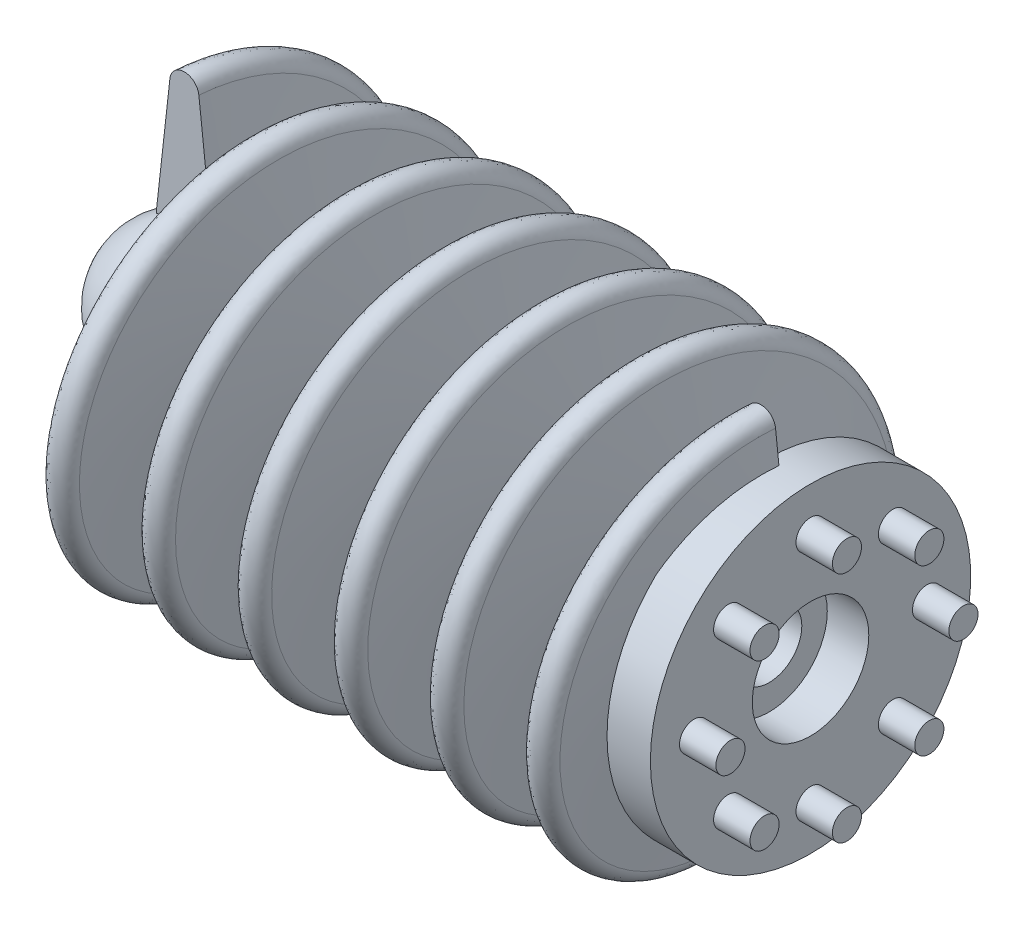
from build123d import *

# Parameters (mm, degrees)
FILLET6_R           = 5
SKETCH9_R           = 4
CUT_EXTRUDE1_DEPTH  = 2.85
SKETCH10_R          = 2.25
CUT_EXTRUDE2_DEPTH  = 2.5
SKETCH11_R          = 1
BOSS_EXTRUDE1_DEPTH = 2.5
CIRPATTERN1_COUNT   = 8
SWEEP2_PITCH        = 6.6


with BuildPart() as part:
    # Sketch2 → Revolve1 (revolve)
    with BuildSketch(Plane.XY, mode=Mode.PRIVATE) as revolve1_sk:
        Polygon((-35.423255814, -11.586046512), (12.576744186, -11.586046512), (12.576744186, -0.586046512), (9.6, -0.586046512), (9.6, -6.586046512), (-35.423255814, -6.586046512), align=None)
    revolve(revolve1_sk.sketch.rotate(Axis((-35.423255814, -11.586046512, 0), (1, 0, 0)), 90), axis=Axis((-35.423255814, -11.586046512, 0), (1, 0, 0)))

    # Fillet6
    fillet6_edges = [part.edges().sort_by_distance(p)[0] for p in [
        (-35.423255814, -11.586046512, -5),
    ]]
    fillet(fillet6_edges, radius=FILLET6_R)

    # Sketch9 → Cut-Extrude1 (cut)
    with BuildSketch(Plane(origin=(12.576744186, 0, 0), x_dir=(0, 0, -1), z_dir=(1, 0, 0))):
        with Locations((0, -11.586046512)):
            Circle(SKETCH9_R)
    extrude(amount=-CUT_EXTRUDE1_DEPTH, mode=Mode.SUBTRACT)

    # Sketch10 → Cut-Extrude2 (cut)
    with BuildSketch(Plane(origin=(9.726744186, 0, 0), x_dir=(0, 0, -1), z_dir=(1, 0, 0))):
        with Locations((0, -11.586046512)):
            Circle(SKETCH10_R)
    extrude(amount=-CUT_EXTRUDE2_DEPTH, mode=Mode.SUBTRACT)

    # Sketch11 → Boss-Extrude1 (add)
    with BuildSketch(Plane(origin=(12.576744186, 0, 0), x_dir=(0, 0, -1), z_dir=(1, 0, 0))):
        with Locations(Location((0, -3.586046512, 0), (0, 0, 180))):
            Circle(SKETCH11_R)
    boss_extrude1 = extrude(amount=BOSS_EXTRUDE1_DEPTH)

    # CirPattern1: Boss-Extrude1 ×8 about axis
    cirpattern1_axis = Axis((0, -11.586046512, 0), (1, 0, 0))
    for i in range(1, CIRPATTERN1_COUNT):
        add(boss_extrude1.rotate(cirpattern1_axis, i * 360 / CIRPATTERN1_COUNT))

    # Sweep2: arcs per turn and ends read off the stored shape
    # Sweep2: the profile of Sketch7 screwed along a left-hand helix through 6 turns, 14 arcs to a turn; built about Z, then put on its axis
    sweep2_z = Axis((0, 0, 0), (0, 0, 1))
    sweep2_corners = [(13.111031511, 0, -0.570561072), (5, 0, -1.476744186), (4.3, 0, -1.476744186), (4.3, 0, 0.423255814), (4.3, 0, 2.323255814), (5, 0, 2.323255814), (13.111031511, 0, 1.4170727), (14, 0, 0.423255814)]
    with BuildLine(mode=Mode.PRIVATE) as sweep2_profile:
        Line(sweep2_corners[0], sweep2_corners[1])
        Line(sweep2_corners[1], sweep2_corners[2])
        Line(sweep2_corners[2], sweep2_corners[3])
        Line(sweep2_corners[3], sweep2_corners[4])
        Line(sweep2_corners[4], sweep2_corners[5])
        Line(sweep2_corners[5], sweep2_corners[6])
        ThreePointArc((13.111031511, 0, 1.4170727), (13.745329293, 0, 1.08995233), (14, 0, 0.423255814))
        ThreePointArc((14, 0, 0.423255814), (13.745329293, 0, -0.243440702), (13.111031511, 0, -0.570561072))
    sweep2_cap = Face(sweep2_profile.wire())
    sweep2_arcs = [((13.111031511, 0, 1.4170727), (14, 0, 1.317755094), (14, 0, 0.423255814), (1, 0.7453292931709528, 1)), ((14, 0, 0.423255814), (14, 0, -0.471243466), (13.111031511, 0, -0.570561072), (1, 0.7453292931709528, 1))]  # start, shoulder, end, weights
    sweep2_turn_angles = [0, -12.857142857, -25.714285714, -38.571428571, -51.428571429, -64.285714286, -77.142857143, -90, -102.857142857, -115.714285714, -128.571428571, -141.428571429, -154.285714286, -167.142857143, -180, -192.857142857, -205.714285714, -218.571428571, -231.428571429, -244.285714286, -257.142857143, -270, -282.857142857, -295.714285714, -308.571428571, -321.428571429, -334.285714286, -347.142857143, -360]
    sweep2_turn_weights = [1, 0.9749279121818236, 1, 0.9749279121818236, 1, 0.9749279121818236, 1, 0.9749279121818236, 1, 0.9749279121818236, 1, 0.9749279121818236, 1, 0.9749279121818236, 1, 0.9749279121818236, 1, 0.9749279121818236, 1, 0.9749279121818236, 1, 0.9749279121818236, 1, 0.9749279121818237, 1, 0.9749279121818236, 1, 0.9749279121818236, 1]
    sweep2_turn_rails = [Edge.make_bspline([Vector(p[0], p[1], 0).rotate(sweep2_z, sweep2_turn_angles[k]) / sweep2_turn_weights[k] + Vector(0, 0, p[2] + -SWEEP2_PITCH * sweep2_turn_angles[k] / 360) for k in range(29)], [0, 0, 0, 1, 1, 2, 2, 3, 3, 4, 4, 5, 5, 6, 6, 7, 7, 8, 8, 9, 9, 10, 10, 11, 11, 12, 12, 13, 13, 14, 14, 14], 2, sweep2_turn_weights) for p in sweep2_corners]
    sweep2_turn_sides = [*[Face.make_surface_from_curves(sweep2_turn_rails[p[0]], sweep2_turn_rails[p[1]]) for p in [(0, 1), (1, 2), (2, 3), (3, 4), (4, 5), (5, 6)]], *[Face.make_bezier_surface([[Vector(p[j][0], p[j][1], 0).rotate(sweep2_z, sweep2_turn_angles[2 * i + k]) / sweep2_turn_weights[2 * i + k] + Vector(0, 0, p[j][2] + -SWEEP2_PITCH * sweep2_turn_angles[2 * i + k] / 360) for k in range(3)] for j in range(3)], [[p[3][j] * sweep2_turn_weights[2 * i + k] for k in range(3)] for j in range(3)]) for p in sweep2_arcs for i in range(14)]]
    sweep2 = Plane(origin=(9.6, -11.586046512, 0), x_dir=(0, 1, 0), z_dir=(-1, 0, 0)) * Solid(Shell([*[p.moved(Location((0, 0, SWEEP2_PITCH * i))) for i in range(6) for p in sweep2_turn_sides], sweep2_cap, sweep2_cap.rotate(sweep2_z, -2160).moved(Location((0, 0, -SWEEP2_PITCH * -2160 / 360)))]))
    add(sweep2)


solid = part.part
